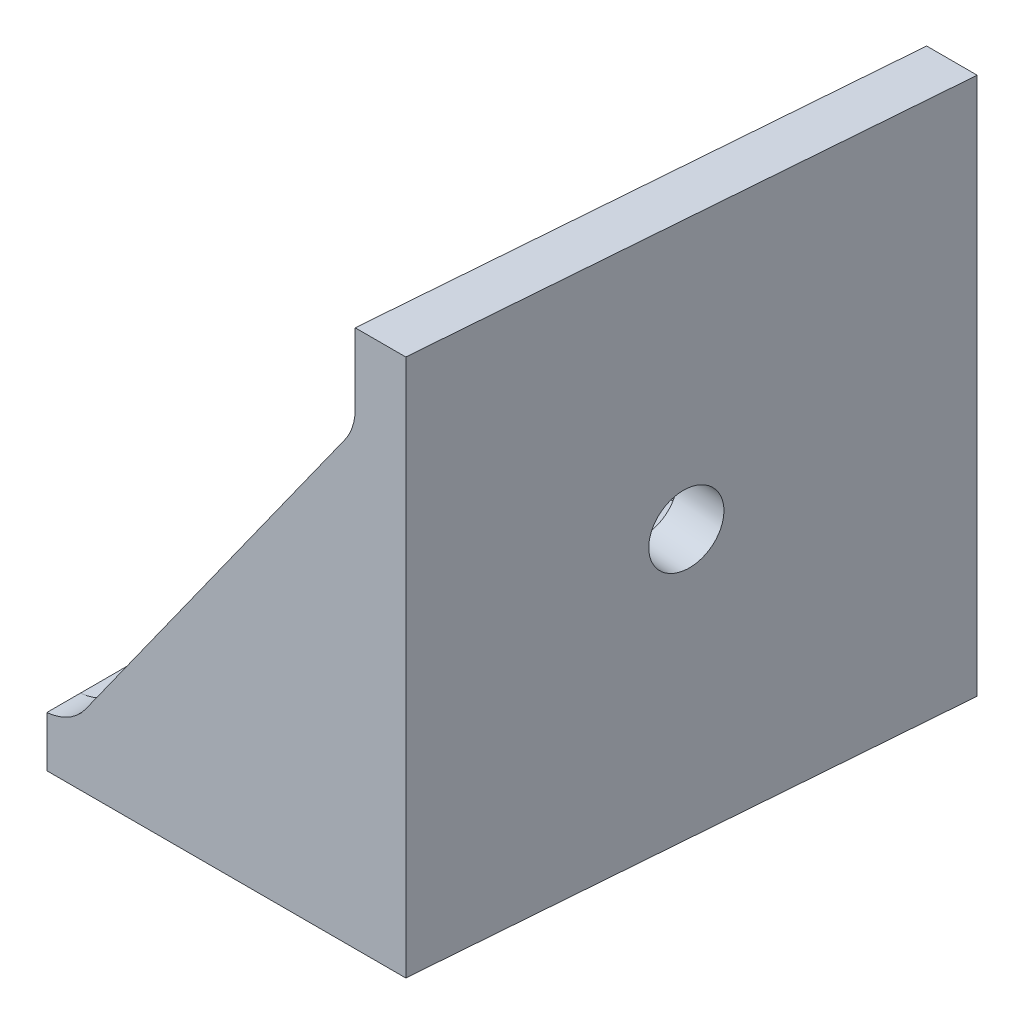
from build123d import *

# Parameters (mm, degrees)
SKETCH1_R           = 2.667
BOSS_EXTRUDE1_DEPTH = 4.7625
BOSS_EXTRUDE2_DEPTH = 50.8
SKETCH4_R           = 3.302
CUT_EXTRUDE1_DEPTH  = 55.626
BOSS_EXTRUDE3_DEPTH = 50.038
CUT_EXTRUDE5_DEPTH  = 46.0375
BOSS_EXTRUDE4_DEPTH = 3.175
BOSS_EXTRUDE5_DEPTH = 3.175
FILLET1_R           = 5.08
FILLET2_R           = 5.08


with BuildPart() as part:
    # Sketch1 → Boss-Extrude1 (new body)
    with BuildSketch(Plane(origin=(0, 0, 0), x_dir=(1, 0, 0), z_dir=(0, 1, 0))):
        Polygon((37.846, 50.038), (33.907923994, 0), (0, 0), (0, 50.038), align=None)
        with Locations(Location((12.7, 37.338, 0), (0, 0, 90))):
            Circle(SKETCH1_R, mode=Mode.SUBTRACT)
        with Locations(Location((25.4, 37.338, 0), (0, 0, 90))):
            Circle(SKETCH1_R, mode=Mode.SUBTRACT)
        with Locations(Location((12.7, 11.938, 0), (0, 0, 90))):
            Circle(SKETCH1_R, mode=Mode.SUBTRACT)
        with Locations(Location((25.4, 11.938, 0), (0, 0, 90))):
            Circle(SKETCH1_R, mode=Mode.SUBTRACT)
    extrude(amount=BOSS_EXTRUDE1_DEPTH)

    # Sketch2 → Boss-Extrude2 (add)
    with BuildSketch(Plane.XZ):
        Polygon((29.2288268, -1.246852262), (33.068773405, -50.038), (37.846, -50.038), (33.907923994, 0), (29.130697399, 0), (29.160105192, -0.373661443), align=None)
    extrude(amount=-BOSS_EXTRUDE2_DEPTH)

    # Sketch4 → Cut-Extrude1 (cut)
    with BuildSketch(Plane(origin=(28.951373786, 0, 2.278522532), x_dir=(-0.07845909572784877, 0, 0.9969173337331276), z_dir=(-0.9969173337331276, 0, -0.07845909572784877))):
        with Locations((-27.304568176, 25.4)):
            Circle(SKETCH4_R)
    extrude(amount=-CUT_EXTRUDE1_DEPTH, mode=Mode.SUBTRACT)

    # Sketch5 → Boss-Extrude3 (add)
    with BuildSketch(Plane.XY):
        Polygon((2.157923994, 4.7625), (33.907923994, 16.318554938), (33.907923994, 4.7625), align=None)
    extrude(amount=-BOSS_EXTRUDE3_DEPTH)

    # Sketch7 → Cut-Extrude5 (cut)
    with BuildSketch(Plane(origin=(0, 50.8, 0), x_dir=(1, 0, 0), z_dir=(0, 1, 0))):
        Polygon((33.068773405, 50.038), (31.224674361, 26.6065), (2.157923994, 26.6065), (2.157923994, 50.038), align=None)
        Polygon((2.157923994, 23.4315), (30.974796442, 23.4315), (29.130697399, 0), (2.157923994, 0), align=None)
    extrude(amount=-CUT_EXTRUDE5_DEPTH, mode=Mode.SUBTRACT)

    # Sketch8 → Boss-Extrude4 (add)
    with BuildSketch(Plane.XY):
        Polygon((2.157923994, 4.7625), (33.907923994, 49.2125), (33.907923994, 4.7625), align=None)
    extrude(amount=-BOSS_EXTRUDE4_DEPTH)

    # Sketch9 → Boss-Extrude5 (add)
    with BuildSketch(Plane(origin=(0, 0, -50.038), x_dir=(-1, 0, 0), z_dir=(0, 0, -1))):
        Polygon((-2.157923994, 4.7625), (-33.068773405, 47.9425), (-33.068773405, 4.7625), align=None)
    extrude(amount=-BOSS_EXTRUDE5_DEPTH)

    # Fillet1
    # the kernel refuses this fillet: 5.08 mm, written as the material it adds along each edge
    with BuildSketch(Plane(origin=(2.157923994, 4.7625, 0), x_dir=(-1, 0, 0), z_dir=(0, 0, -1))) as fillet1_piece_1:
        with BuildLine():
            CenterArc((2.629957643, 5.058021771), FILLET1_R, 215.537677792, 49.130706658)
            Line((-1.503808391, 2.105331747), (-1.586483711, 2.046277946))
            Line((-1.586483711, 2.046277946), (-0.082675321, -0.0590538))
            Line((-0.082675321, -0.0590538), (0, -0.1016))
            ThreePointArc((0, -0.1016), (1.078961997, -0.1016), (2.148483321, -0.101160435))
            Line((2.148483321, -0.101160435), (2.157923994, 0))
        make_face()
    extrude(amount=3.175)
    with BuildSketch(Plane(origin=(2.157923994, 4.7625, -50.038), x_dir=(-1, 0, 0), z_dir=(0, 0, 1))) as fillet1_piece_2:
        with BuildLine():
            CenterArc((2.626409807, -5.058351613), FILLET1_R, 95.291428018, 49.111198854)
            Line((-1.504277635, -2.101356304), (-1.586891383, -2.042216397))
            Line((-1.586891383, -2.042216397), (-0.082613749, 0.059139906))
            Line((-0.082613749, 0.059139906), (0, 0.1016))
            ThreePointArc((0, 0.1016), (1.078961997, 0.1016), (2.148554278, 0.101167032))
            Line((2.148554278, 0.101167032), (2.157923994, 0))
        make_face()
    extrude(amount=3.175)
    with BuildSketch(Plane(origin=(29.700338722, 43.32188062, -7.237979285), x_dir=(-0.008566636475351457, 0.9940213341844409, 0.10884943695620641), z_dir=(-0.07799001501429913, -0.10918602102001876, 0.9909570981489993))) as fillet1_piece_3_section:
        with BuildLine():
            CenterArc((FILLET1_R * 0.322839030398, FILLET1_R), FILLET1_R, 234.215790713, 35.784209287)
            Line((-FILLET1_R * 0.261895093237, FILLET1_R * 0.188774997515), (-FILLET1_R * 0.27358977571, FILLET1_R * 0.172550497465))
            Line((-FILLET1_R * 0.27358977571, FILLET1_R * 0.172550497465), (-FILLET1_R * 0.00645678060796, -FILLET1_R * 0.02))
            Line((-FILLET1_R * 0.00645678060796, -FILLET1_R * 0.02), (FILLET1_R * 0.322839030398, -FILLET1_R * 0.02))
            Line((FILLET1_R * 0.322839030398, -FILLET1_R * 0.02), (FILLET1_R * 0.322839030398, 0))
        make_face()
    fillet1_piece_3 = extrude(amount=11.404084587, mode=Mode.PRIVATE)
    fillet1_piece_3 = split(fillet1_piece_3, bisect_by=Plane(origin=(29.0621266, 42.760284123, 0), z_dir=(0, 0, -1)), keep=Keep.TOP, mode=Mode.PRIVATE)
    fillet1_piece_3 = split(fillet1_piece_3, bisect_by=Plane(origin=(29.0621266, 42.760284123, -3.175), z_dir=(0, 0, 1)), keep=Keep.TOP, mode=Mode.PRIVATE)
    add(fillet1_piece_3)
    with BuildSketch(Plane(origin=(32.498558986, 47.145955774, -42.792738849), x_dir=(-0.008548017001345628, 0.994047372778579, 0.1086128541073727), z_dir=(0.07799205797884924, 0.10894870661005905, -0.9909830564748416))) as fillet1_piece_4_section:
        with BuildLine():
            CenterArc((FILLET1_R * 0.32340916623, -FILLET1_R), FILLET1_R, 90, 35.843365579)
            Line((-FILLET1_R * 0.262162212759, -FILLET1_R * 0.189379151447), (-FILLET1_R * 0.273873640339, -FILLET1_R * 0.173166734476))
            Line((-FILLET1_R * 0.273873640339, -FILLET1_R * 0.173166734476), (-FILLET1_R * 0.0064681833246, FILLET1_R * 0.02))
            Line((-FILLET1_R * 0.0064681833246, FILLET1_R * 0.02), (FILLET1_R * 0.32340916623, FILLET1_R * 0.02))
            Line((FILLET1_R * 0.32340916623, FILLET1_R * 0.02), (FILLET1_R * 0.32340916623, 0))
        make_face()
    fillet1_piece_4 = extrude(amount=11.418482111, mode=Mode.PRIVATE)
    fillet1_piece_4 = split(fillet1_piece_4, bisect_by=Plane(origin=(32.749606974, 47.829296301, -50.038), z_dir=(0, 0, 1)), keep=Keep.TOP, mode=Mode.PRIVATE)
    fillet1_piece_4 = split(fillet1_piece_4, bisect_by=Plane(origin=(32.749606974, 47.829296301, -46.863), z_dir=(0, 0, -1)), keep=Keep.TOP, mode=Mode.PRIVATE)
    add(fillet1_piece_4)

    # Fillet2
    fillet2_edges = [part.edges().sort_by_distance(p)[0] for p in [
        (32.818895486, 27.004348608, -46.863),
        (29.380575318, 24.643299124, -3.175),
    ]]
    fillet(fillet2_edges, radius=FILLET2_R)


solid = part.part
